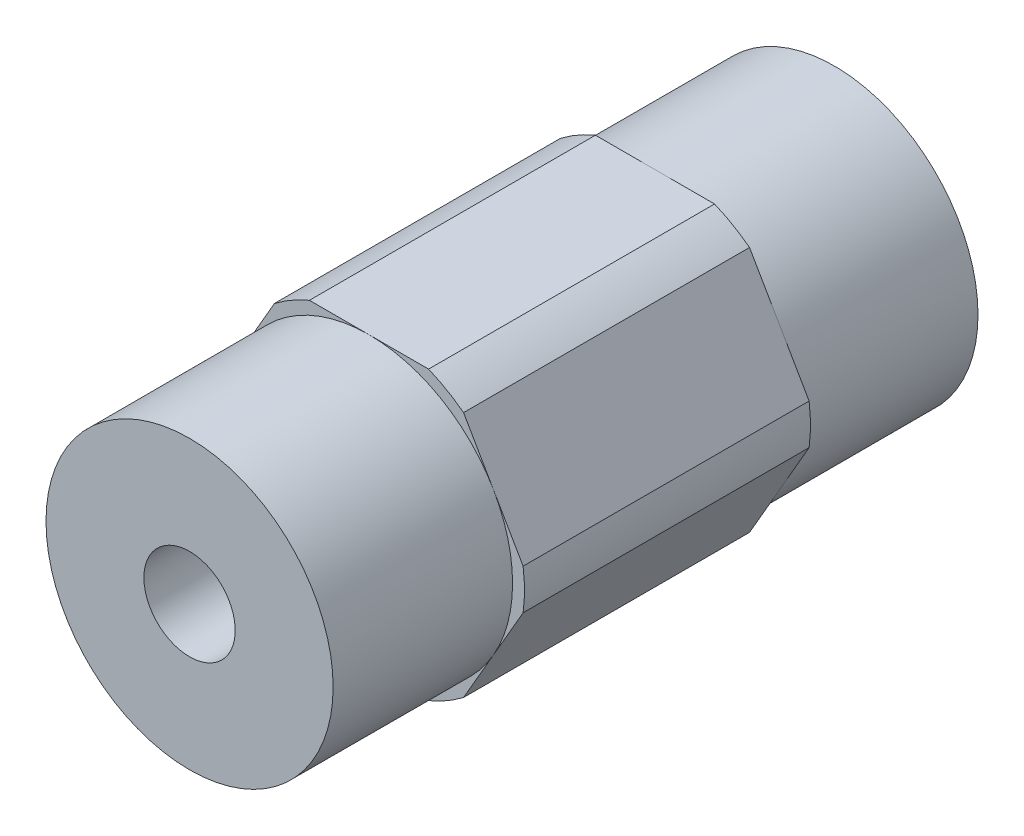
from build123d import *

# Parameters (mm, degrees)
SKETCH1_R                            = 2.0193
BOSS_EXTRUDE1_DEPTH                  = 14.2621
F_10_32_TAPPED_HOLE1_D               = 4.0386
F_10_32_TAPPED_HOLE1_DEPTH           = 11.938
F_10_32_TAPPED_HOLE1_TIP             = 1.213317848
F_10_32_TAPPED_HOLE1_ON_FACE_2_D     = 4.0386
F_10_32_TAPPED_HOLE1_ON_FACE_2_DEPTH = 11.938
F_10_32_TAPPED_HOLE1_ON_FACE_2_TIP   = 1.213317848
SKETCH4_R                            = 8.89
SKETCH4_R_2                          = 6.35
CUT_EXTRUDE_THIN1_DEPTH              = 7.9375


with BuildPart() as part:
    # Sketch1 → Boss-Extrude1 (new, symmetric)
    with BuildSketch(Plane.XY):
        with BuildLine():
            ThreePointArc((6.874999966, 0), (6.860422465, 0.447468582), (6.816751782, 0.893039571))
            Line((6.816751782, 0.893039571), (4.181770846, 5.456960429))
            ThreePointArc((4.181770846, 5.456960429), (3.437499983, 5.953924622), (2.634980936, 6.35))
            Line((2.634980936, 6.35), (-2.634980936, 6.35))
            ThreePointArc((-2.634980936, 6.35), (-3.437499983, 5.953924622), (-4.181770846, 5.456960429))
            Line((-4.181770846, 5.456960429), (-6.816751782, 0.893039571))
            ThreePointArc((-6.816751782, 0.893039571), (-6.874999966, 0), (-6.816751782, -0.893039571))
            Line((-6.816751782, -0.893039571), (-4.181770846, -5.456960429))
            ThreePointArc((-4.181770846, -5.456960429), (-3.437499983, -5.953924622), (-2.634980936, -6.35))
            Line((-2.634980936, -6.35), (2.634980936, -6.35))
            ThreePointArc((2.634980936, -6.35), (3.437499983, -5.953924622), (4.181770846, -5.456960429))
            Line((4.181770846, -5.456960429), (6.816751782, -0.893039571))
            ThreePointArc((6.816751782, -0.893039571), (6.860422465, -0.447468582), (6.874999966, 0))
        make_face()
        Circle(SKETCH1_R, mode=Mode.SUBTRACT)
    extrude(amount=BOSS_EXTRUDE1_DEPTH, both=True)

    # #10-32 Tapped Hole1
    with Locations(Plane.XY.offset(14.2621)):
        with Locations((0, 0)):
            Hole(F_10_32_TAPPED_HOLE1_D / 2, depth=F_10_32_TAPPED_HOLE1_DEPTH)
            with Locations((0, 0, -(F_10_32_TAPPED_HOLE1_DEPTH + F_10_32_TAPPED_HOLE1_TIP / 2))):  # 118° drill point
                Cone(0, F_10_32_TAPPED_HOLE1_D / 2, F_10_32_TAPPED_HOLE1_TIP, mode=Mode.SUBTRACT)

    # #10-32 Tapped Hole1 on face 2
    with Locations(Plane.XY.offset(-14.2621)):
        with Locations((0, 0)):
            Hole(F_10_32_TAPPED_HOLE1_ON_FACE_2_D / 2, depth=F_10_32_TAPPED_HOLE1_ON_FACE_2_DEPTH)
            with Locations((0, 0, -(F_10_32_TAPPED_HOLE1_ON_FACE_2_DEPTH + F_10_32_TAPPED_HOLE1_ON_FACE_2_TIP / 2))):  # 118° drill point
                Cone(0, F_10_32_TAPPED_HOLE1_ON_FACE_2_D / 2, F_10_32_TAPPED_HOLE1_ON_FACE_2_TIP, mode=Mode.SUBTRACT)

    # Sketch4 → Cut-Extrude-Thin1 (cut)
    with BuildSketch(Plane.XY.offset(14.2621)):
        Circle(SKETCH4_R)
        Circle(SKETCH4_R_2, mode=Mode.SUBTRACT)
    cut_extrude_thin1 = extrude(amount=-CUT_EXTRUDE_THIN1_DEPTH, mode=Mode.SUBTRACT)

    # Mirror1: Cut-Extrude-Thin1 across plane
    add(cut_extrude_thin1.mirror(Plane.XY), mode=Mode.SUBTRACT)


solid = part.part
